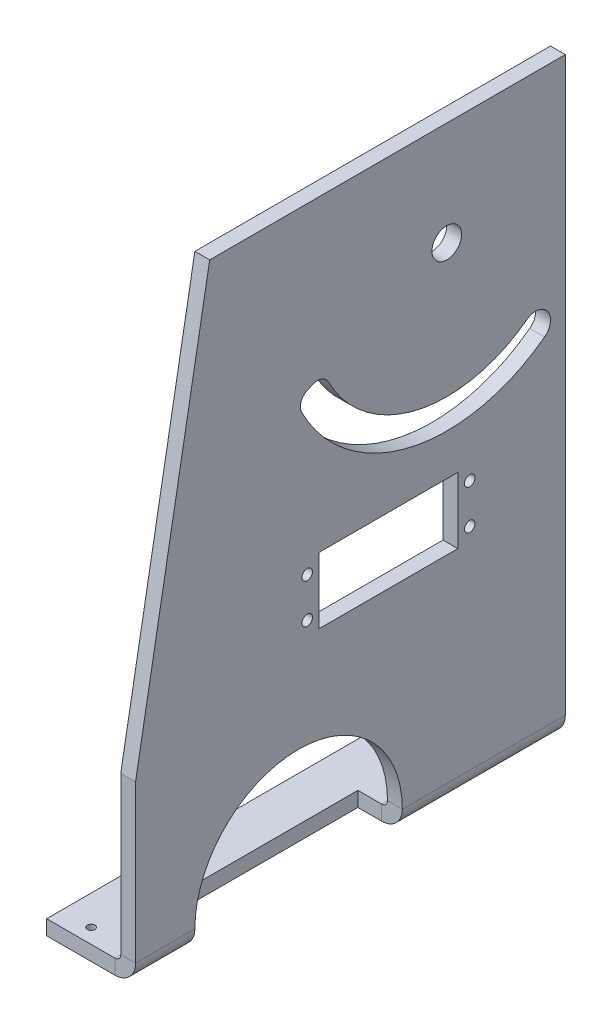
from build123d import *

# Parameters (mm, degrees)
BOSS_EXTRUDE1_DEPTH  = 6.35
SKETCH5_W            = 184.15
SKETCH5_H            = 6.35
BOSS_EXTRUDE4_DEPTH  = 31.75
SKETCH6_W            = 12.7
SKETCH6_H            = 88.9
CUT_EXTRUDE2_DEPTH   = 291.872284044
CUT_EXTRUDE3_REACH   = 299.045
SKETCH7_R            = 2.25
SKETCH7_W            = 59.436
SKETCH7_H            = 28.313784743
SKETCH8_R            = 6.35
CUT_EXTRUDE4_DEPTH   = 298.044963979
FILLET1_R            = 2.54
CONVERT_SOLID1_START = -34.925
CONVERT_SOLID1_DEPTH = 184.15
CUT_EXTRUDE5_REACH   = 299.045
CUT_EXTRUDE6_REACH   = 292.872
SKETCH10_R           = 1.63195


# Read off the part's stored shape, not the designer's step: Convert-Solid1
with BuildPart() as part:
    # Sketch1 → Boss-Extrude1 (new body)
    with BuildSketch(Plane(origin=(0, 0, 0), x_dir=(0, 0, -1), z_dir=(1, 0, 0))):
        with BuildLine():
            Line((-117.475, 254), (34.925, 254))
            Line((34.925, 254), (34.925, 8.89))
            Line((34.925, 8.89), (34.925, 0))
            Line((34.925, 0), (-34.925, 0))
            Line((-34.925, 0), (-34.925, 8.89))
            ThreePointArc((-34.925, 8.89), (-79.375, 53.34), (-123.825, 8.89))
            Line((-123.825, 8.89), (-123.825, 0))
            Line((-123.825, 0), (-149.225, 0))
            Line((-149.225, 0), (-149.225, 76.2))
            Line((-149.225, 76.2), (-117.475, 254))
        make_face()
    extrude(amount=BOSS_EXTRUDE1_DEPTH)

    # Sketch5 → Boss-Extrude4 (add)
    with BuildSketch(Plane.ZY):
        with Locations((57.15, 3.175)):
            Rectangle(SKETCH5_W, SKETCH5_H)
    extrude(amount=BOSS_EXTRUDE4_DEPTH)

    # Sketch6 → Cut-Extrude2 (cut, through all)
    with BuildSketch(Plane(origin=(0, 6.35, 0), x_dir=(1, 0, 0), z_dir=(0, 1, 0))):
        with Locations((-6.35, -79.375)):
            Rectangle(SKETCH6_W, SKETCH6_H)
    extrude(amount=-CUT_EXTRUDE2_DEPTH, mode=Mode.SUBTRACT)

    # Sketch7 → Cut-Extrude3 (cut, up to next)
    with BuildSketch(Plane(origin=(6.35, 0, 0), x_dir=(0, 0, -1), z_dir=(1, 0, 0)), mode=Mode.PRIVATE) as cut_extrude3_sk1:
        with Locations((-75.679460058, 116.337237118)):
            Circle(SKETCH7_R)
    cut_extrude3_tool1 = extrude(cut_extrude3_sk1.sketch, amount=-CUT_EXTRUDE3_REACH, mode=Mode.PRIVATE) & part.part
    # Sketch7 → Cut-Extrude3 (cut, up to next)
    with BuildSketch(Plane(origin=(6.35, 0, 0), x_dir=(0, 0, -1), z_dir=(1, 0, 0)), mode=Mode.PRIVATE) as cut_extrude3_sk2:
        with Locations((-75.679460058, 99.360389657)):
            Circle(SKETCH7_R)
    cut_extrude3_tool2 = extrude(cut_extrude3_sk2.sketch, amount=-CUT_EXTRUDE3_REACH, mode=Mode.PRIVATE) & part.part
    # Sketch7 → Cut-Extrude3 (cut, up to next)
    with BuildSketch(Plane(origin=(6.35, 0, 0), x_dir=(0, 0, -1), z_dir=(1, 0, 0)), mode=Mode.PRIVATE) as cut_extrude3_sk3:
        with Locations((-6.03755368, 99.360389657)):
            Circle(SKETCH7_R)
    cut_extrude3_tool3 = extrude(cut_extrude3_sk3.sketch, amount=-CUT_EXTRUDE3_REACH, mode=Mode.PRIVATE) & part.part
    # Sketch7 → Cut-Extrude3 (cut, up to next)
    with BuildSketch(Plane(origin=(6.35, 0, 0), x_dir=(0, 0, -1), z_dir=(1, 0, 0)), mode=Mode.PRIVATE) as cut_extrude3_sk4:
        with Locations((-6.03755368, 116.337237118)):
            Circle(SKETCH7_R)
    cut_extrude3_tool4 = extrude(cut_extrude3_sk4.sketch, amount=-CUT_EXTRUDE3_REACH, mode=Mode.PRIVATE) & part.part
    # Sketch7 → Cut-Extrude3 (cut, up to next)
    with BuildSketch(Plane(origin=(6.35, 0, 0), x_dir=(0, 0, -1), z_dir=(1, 0, 0)), mode=Mode.PRIVATE) as cut_extrude3_sk5:
        with Locations((-40.858506869, 107.848813388)):
            Rectangle(SKETCH7_W, SKETCH7_H)
    cut_extrude3_tool5 = extrude(cut_extrude3_sk5.sketch, amount=-CUT_EXTRUDE3_REACH, mode=Mode.PRIVATE) & part.part
    add(cut_extrude3_tool1.solids().sort_by_distance((6.35, 116.337237, 75.67946))[0], mode=Mode.SUBTRACT)
    add(cut_extrude3_tool2.solids().sort_by_distance((6.35, 99.36039, 75.67946))[0], mode=Mode.SUBTRACT)
    add(cut_extrude3_tool3.solids().sort_by_distance((6.35, 99.36039, 6.037554))[0], mode=Mode.SUBTRACT)
    add(cut_extrude3_tool4.solids().sort_by_distance((6.35, 116.337237, 6.037554))[0], mode=Mode.SUBTRACT)
    add(cut_extrude3_tool5.solids().sort_by_distance((6.35, 107.848813, 40.858507))[0], mode=Mode.SUBTRACT)

    # Sketch8 → Cut-Extrude4 (cut, through all)
    with BuildSketch(Plane(origin=(6.35, 0, 0), x_dir=(0, 0, -1), z_dir=(1, 0, 0))):
        with Locations((-15.875, 209.55)):
            Circle(SKETCH8_R)
    extrude(amount=-CUT_EXTRUDE4_DEPTH, mode=Mode.SUBTRACT)

    # Fillet1
    fillet1_edges = [part.edges().sort_by_distance(p)[0] for p in [
        (0, 6.35, 136.525),
        (0, 6.35, 0),
    ]]
    fillet(fillet1_edges, radius=FILLET1_R)

    # Convert-Solid1 outline → Convert-Solid1 (cut)
    with BuildSketch(Plane.XY.offset(CONVERT_SOLID1_START)):
        with BuildLine():
            ThreePointArc((6.35, 8.89), (3.746179285, 2.603820715), (-2.54, 0))
            Line((-2.54, 0), (6.35, 0))
            Line((6.35, 0), (6.35, 8.89))
        make_face()
    extrude(amount=CONVERT_SOLID1_DEPTH, mode=Mode.SUBTRACT)

    # Sketch9 → Cut-Extrude5 (cut, up to next)
    with BuildSketch(Plane(origin=(6.35, 0, 0), x_dir=(0, 0, -1), z_dir=(1, 0, 0)), mode=Mode.PRIVATE) as cut_extrude5_sk1:
        with BuildLine():
            Line((-75.494212356, 184.752903033), (-73.141435562, 185.731480776))
            ThreePointArc((-73.141435562, 185.731480776), (-69.446832384, 185.812370314), (-66.675, 183.368279277))
            ThreePointArc((-66.675, 183.368279277), (-28.664883279, 153.84953873), (18.415, 163.83))
            ThreePointArc((18.415, 163.83), (27.305, 162.56), (26.035, 153.67))
            ThreePointArc((26.035, 153.67), (-31.616379009, 141.496848075), (-78.066338809, 177.749687467))
            ThreePointArc((-78.066338809, 177.749687467), (-78.311881244, 181.813820193), (-75.494212356, 184.752903033))
        make_face()
    cut_extrude5_tool1 = extrude(cut_extrude5_sk1.sketch, amount=-CUT_EXTRUDE5_REACH, mode=Mode.PRIVATE) & part.part
    add(cut_extrude5_tool1.solids().sort_by_distance((6.35, 181.411079, 77.215324))[0], mode=Mode.SUBTRACT)

    # Sketch10 → Cut-Extrude6 (cut, up to next)
    with BuildSketch(Plane(origin=(0, 6.35, 0), x_dir=(1, 0, 0), z_dir=(0, 1, 0)), mode=Mode.PRIVATE) as cut_extrude6_sk1:
        with Locations(Location((-19.05, 9.525, 0), (0, 0, 270))):
            Circle(SKETCH10_R)
    cut_extrude6_tool1 = extrude(cut_extrude6_sk1.sketch, amount=-CUT_EXTRUDE6_REACH, mode=Mode.PRIVATE) & part.part
    # Sketch10 → Cut-Extrude6 (cut, up to next)
    with BuildSketch(Plane(origin=(0, 6.35, 0), x_dir=(1, 0, 0), z_dir=(0, 1, 0)), mode=Mode.PRIVATE) as cut_extrude6_sk2:
        with Locations(Location((-19.05, -15.875, 0), (0, 0, 270))):
            Circle(SKETCH10_R)
    cut_extrude6_tool2 = extrude(cut_extrude6_sk2.sketch, amount=-CUT_EXTRUDE6_REACH, mode=Mode.PRIVATE) & part.part
    # Sketch10 → Cut-Extrude6 (cut, up to next)
    with BuildSketch(Plane(origin=(0, 6.35, 0), x_dir=(1, 0, 0), z_dir=(0, 1, 0)), mode=Mode.PRIVATE) as cut_extrude6_sk3:
        with Locations(Location((-19.05, -142.875, 0), (0, 0, 270))):
            Circle(SKETCH10_R)
    cut_extrude6_tool3 = extrude(cut_extrude6_sk3.sketch, amount=-CUT_EXTRUDE6_REACH, mode=Mode.PRIVATE) & part.part
    add(cut_extrude6_tool1.solids().sort_by_distance((-19.05, 6.35, -9.525))[0], mode=Mode.SUBTRACT)
    add(cut_extrude6_tool2.solids().sort_by_distance((-19.05, 6.35, 15.875))[0], mode=Mode.SUBTRACT)
    add(cut_extrude6_tool3.solids().sort_by_distance((-19.05, 6.35, 142.875))[0], mode=Mode.SUBTRACT)


solid = part.part
